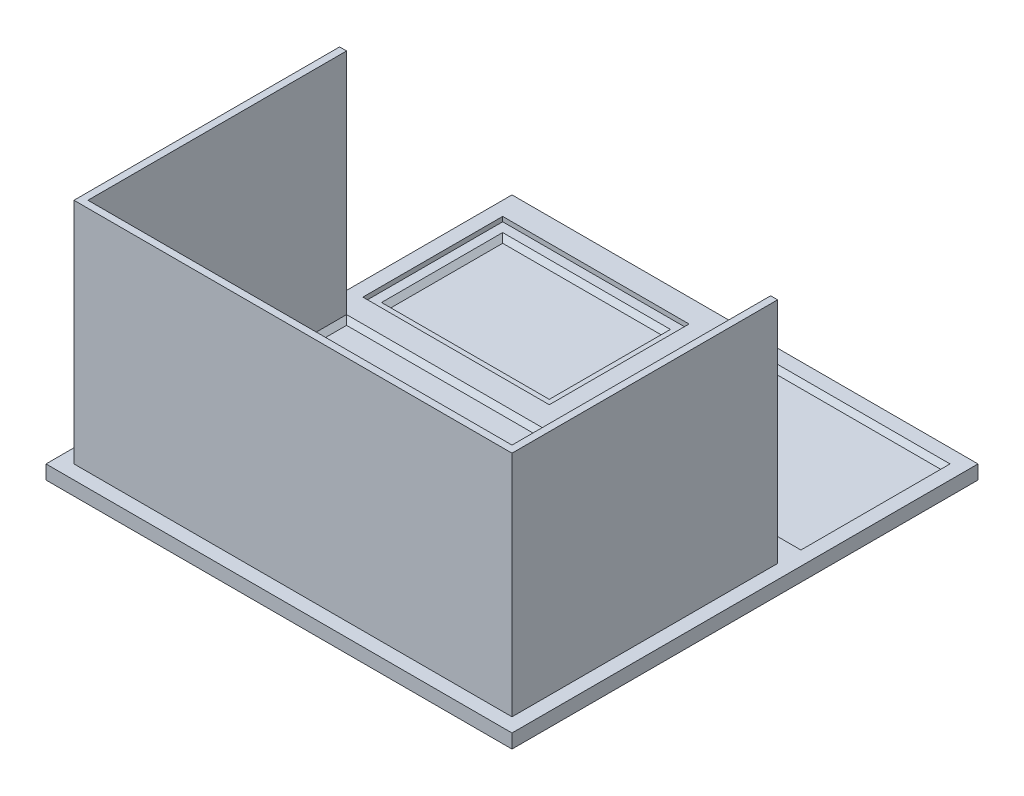
from build123d import *

# Parameters (mm, degrees)
SKETCH1_W           = 1000
SKETCH1_H           = 1000
BOSS_EXTRUDE1_DEPTH = 30
SKETCH2_W           = 400
SKETCH2_H           = 300
CUT_EXTRUDE1_DEPTH  = 20
SKETCH3_W           = 400
SKETCH3_H           = 300
SKETCH3_W_2         = 360
SKETCH3_H_2         = 260
BOSS_EXTRUDE2_DEPTH = 10
CHAMFER1_SIZE       = 10
SKETCH5_W           = 490
SKETCH5_H           = 320
SKETCH5_W_2         = 940
SKETCH5_H_2         = 570
CUT_EXTRUDE2_DEPTH  = 10
BOSS_EXTRUDE5_DEPTH = 500
CHAMFER3_SIZE       = 10


with BuildPart() as part:
    # Sketch1 → Boss-Extrude1 (new body)
    with BuildSketch(Plane(origin=(0, 0, 0), x_dir=(1, 0, 0), z_dir=(0, 1, 0))):
        with Locations((500, -500)):
            Rectangle(SKETCH1_W, SKETCH1_H)
    extrude(amount=BOSS_EXTRUDE1_DEPTH)

    # Sketch2 → Cut-Extrude1 (cut)
    with BuildSketch(Plane(origin=(0, 30, 0), x_dir=(1, 0, 0), z_dir=(0, 1, 0))):
        with Locations((230, -200)):
            Rectangle(SKETCH2_W, SKETCH2_H)
    extrude(amount=-CUT_EXTRUDE1_DEPTH, mode=Mode.SUBTRACT)

    # Sketch3 → Boss-Extrude2 (add)
    with BuildSketch(Plane(origin=(0, 10, 0), x_dir=(1, 0, 0), z_dir=(0, 1, 0))):
        with Locations((230, -200)):
            Rectangle(SKETCH3_W, SKETCH3_H)
        with Locations((230, -200)):
            Rectangle(SKETCH3_W_2, SKETCH3_H_2, mode=Mode.SUBTRACT)
    extrude(amount=BOSS_EXTRUDE2_DEPTH)

    # Chamfer1
    chamfer1_edges = [part.edges().sort_by_distance(p)[0] for p in [
        (230, 10, 70),
        (410, 10, 200),
        (230, 10, 330),
        (50, 10, 200),
    ]]
    chamfer(chamfer1_edges, length=CHAMFER1_SIZE - 0.0001)  # a hair under: the kernel refuses the full size

    # Sketch5 → Cut-Extrude2 (cut)
    with BuildSketch(Plane(origin=(0, 30, 0), x_dir=(1, 0, 0), z_dir=(0, 1, 0))):
        with Locations((725, -190)):
            Rectangle(SKETCH5_W, SKETCH5_H)
        with Locations((500, -685)):
            Rectangle(SKETCH5_W_2, SKETCH5_H_2)
    extrude(amount=-CUT_EXTRUDE2_DEPTH, mode=Mode.SUBTRACT)

    # Sketch7 → Boss-Extrude5 (add)
    with BuildSketch(Plane(origin=(0, 20, 0), x_dir=(1, 0, 0), z_dir=(0, 1, 0))):
        Polygon((970, -400), (955, -400), (955, -955), (45, -955), (45, -400), (30, -400), (30, -970), (970, -970), align=None)
    extrude(amount=BOSS_EXTRUDE5_DEPTH)

    # Chamfer3
    chamfer3_edges = [part.edges().sort_by_distance(p)[0] for p in [
        (725, 20, 30),
        (970, 20, 190),
        (725, 20, 350),
        (480, 20, 190),
        (45, 20, 677.5),
        (500, 20, 400),
        (955, 20, 677.5),
        (500, 20, 955),
    ]]
    chamfer(chamfer3_edges, length=CHAMFER3_SIZE - 0.0001)  # a hair under: the kernel refuses the full size


solid = part.part
